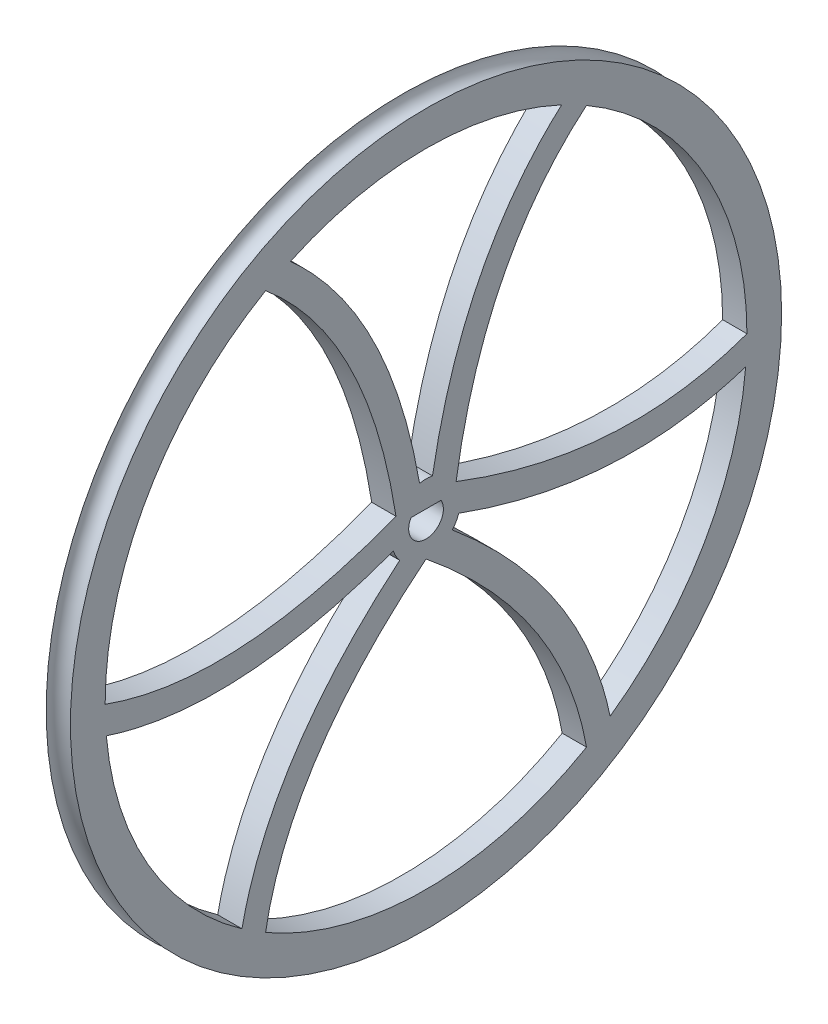
from build123d import *

# Parameters (mm, degrees)
SKETCH3_R           = 5.08
BOSS_EXTRUDE1_DEPTH = 1.778
BOSS_EXTRUDE2_DEPTH = 1.778
CIRPATTERN1_COUNT   = 3


with BuildPart() as part:
    # Sketch1 → Revolve1 (revolve)
    with BuildSketch(Plane.XY):
        with BuildLine():
            Line((-1.778, 46.99), (1.778, 46.99))
            Line((1.778, 46.99), (1.778, 52.07))
            ThreePointArc((1.778, 52.07), (0, 50.292), (-1.778, 52.07))
            Line((-1.778, 52.07), (-1.778, 46.99))
        make_face()
    revolve(axis=Axis((0, 0, 0), (-1, 0, 0)))



with BuildPart() as body_2:
    # Sketch3 → Boss-Extrude1 (new, symmetric)
    with BuildSketch(Plane(origin=(0, 0, 0), x_dir=(0, 0, -1), z_dir=(1, 0, 0))):
        Circle(SKETCH3_R)
        with BuildLine():
            Line((-2.199704526, 1.27), (2.199704526, 1.27))
            ThreePointArc((2.199704526, 1.27), (0, -2.54), (-2.199704526, 1.27))
        make_face(mode=Mode.SUBTRACT)
    extrude(amount=BOSS_EXTRUDE1_DEPTH, both=True)


with BuildPart() as part_1:
    add(part.part)

    add(body_2.part)  # Boss-Extrude2 merges body 2
    # Sketch4 → Boss-Extrude2 (add, symmetric)
    with BuildSketch(Plane(origin=(0, 0, 0), x_dir=(0, 0, -1), z_dir=(1, 0, 0))):
        with BuildLine():
            ThreePointArc((0.944904193, 4.991348121), (2.93984658, 4.142909857), (4.399409051, 2.54))
            add(Edge.make_bspline(
                [(4.399409051, 2.54), (8.403935344, 28.037941582), (23.490541691, 40.697107404)],
                knots=[0, 0, 0, 0.590133113, 0.590133113, 0.590133113], degree=2))
            ThreePointArc((23.490541691, 40.697107404), (21.693933899, 41.682530297), (19.856072817, 42.588689488))
            add(Edge.make_bspline(
                [(0.944904193, 4.991348121), (1.02715539, 5.459743318), (1.310329906, 7.009415216), (2.060001484, 10.619099018), (3.386448928, 15.659125843), (5.353463995, 21.320156508), (8.485114852, 28.357233822), (13.086786467, 35.720460314), (17.591070608, 40.562801698), (19.856072817, 42.588689488)],
                knots=[0.020991891, 0.020991891, 0.020991891, 0.020991891, 0.03688332, 0.073766639, 0.147533278, 0.221299917, 0.295066556, 0.442599834, 0.568485815, 0.568485815, 0.568485815, 0.568485815], degree=3))
        make_face()
        with BuildLine():
            add(Edge.make_bspline(
                [(-4.399409051, 2.54), (-8.403935344, 28.037941582), (-23.490541691, 40.697107404)],
                knots=[0, 0, 0, 0.590133113, 0.590133113, 0.590133113], degree=2))
            ThreePointArc((-4.399409051, 2.54), (-2.93984658, 4.142909857), (-0.944904193, 4.991348121))
            add(Edge.make_bspline(
                [(-0.944904193, 4.991348121), (-1.02715539, 5.459743318), (-1.310329906, 7.009415216), (-2.060001484, 10.619099018), (-3.386448928, 15.659125843), (-5.353463995, 21.320156508), (-8.485114852, 28.357233822), (-13.086786467, 35.720460314), (-17.591070608, 40.562801698), (-19.856072817, 42.588689488)],
                knots=[0.020991891, 0.020991891, 0.020991891, 0.020991891, 0.03688332, 0.073766639, 0.147533278, 0.221299917, 0.295066556, 0.442599834, 0.568485815, 0.568485815, 0.568485815, 0.568485815], degree=3))
            ThreePointArc((-19.856072817, 42.588689488), (-21.693933899, 41.682530297), (-23.490541691, 40.697107404))
        make_face()
    boss_extrude2 = extrude(amount=BOSS_EXTRUDE2_DEPTH, both=True)

    # CirPattern1: Boss-Extrude2 ×3 about axis
    cirpattern1_axis = Axis((1.778, 0, 0), (1, 0, 0))
    for i in range(1, CIRPATTERN1_COUNT):
        add(boss_extrude2.rotate(cirpattern1_axis, i * 360 / CIRPATTERN1_COUNT))


solid = part_1.part
